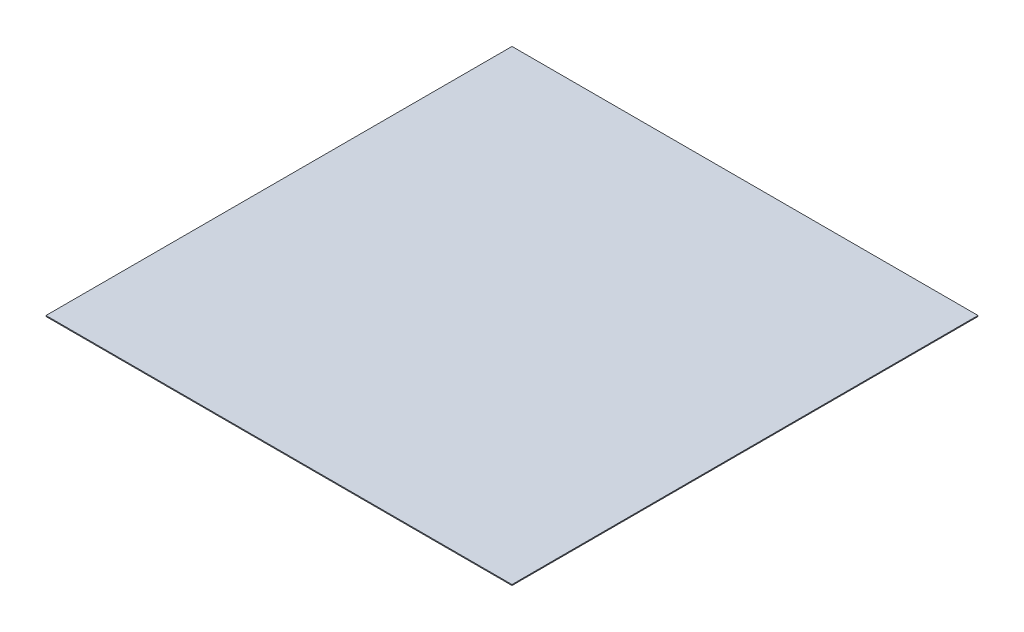
from build123d import *

# Parameters (mm, degrees)
SKETCH_1_W      = 1000
SKETCH_1_H      = 1000
EXTRUDE_1_DEPTH = 2


with BuildPart() as part:
    # 草图1 → 凸台-拉伸1 (new body)
    with BuildSketch(Plane(origin=(0, 0, 0), x_dir=(1, 0, 0), z_dir=(0, 1, 0))):
        Rectangle(SKETCH_1_W, SKETCH_1_H)
    extrude(amount=EXTRUDE_1_DEPTH)


solid = part.part
